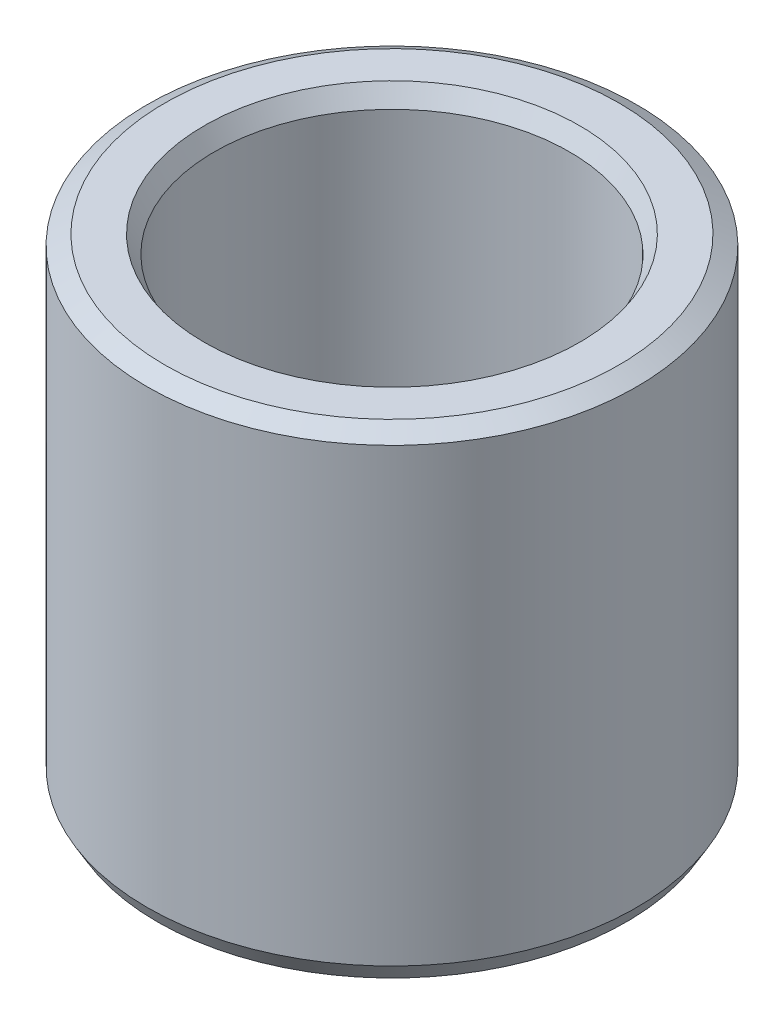
from build123d import *
from OCP.BRepFilletAPI import BRepFilletAPI_MakeChamfer

# Parameters (mm, degrees)
SKETCH1_R           = 37.5
BOSS_EXTRUDE1_DEPTH = 73.37793614
SKETCH2_R           = 27.222754913
CUT_EXTRUDE1_DEPTH  = 91.536299417
CHAMFER1_SIZE       = 1.555312904
CHAMFER1_SIZE2      = 2.693880972


with BuildPart() as part:
    # Sketch1 → Boss-Extrude1 (new body)
    with BuildSketch(Plane(origin=(0, 0, 0), x_dir=(1, 0, 0), z_dir=(0, 1, 0))):
        Circle(SKETCH1_R)
    extrude(amount=BOSS_EXTRUDE1_DEPTH)

    # Sketch2 → Cut-Extrude1 (cut, through all)
    with BuildSketch(Plane(origin=(0, 0, 0), x_dir=(1, 0, 0), z_dir=(0, 1, 0))):
        Circle(SKETCH2_R)
    extrude(amount=CUT_EXTRUDE1_DEPTH, mode=Mode.SUBTRACT)

    # Chamfer1: one chamfer whose edges measure the first distance from different faces: ONE call of the kernel's chamfer builder (chamfer() names one face for all edges)
    chamfer1_edges_1 = [part.edges().sort_by_distance(p)[0] for p in [
        (-27.222754913, 73.37793614, 0),
    ]]
    chamfer1_side_1 = [part.faces().sort_by_distance(p)[0] for p in [
        (-36.439339828, 73.37793614, 0),
    ]]
    chamfer1_edges_2 = [part.edges().sort_by_distance(p)[0] for p in [
        (-27.222754913, 0, 0),
    ]]
    chamfer1_side_2 = [part.faces().sort_by_distance(p)[0] for p in [
        (-27.222754913, 36.68896807, 0),
    ]]
    chamfer1_edges_3 = [part.edges().sort_by_distance(p)[0] for p in [
        (-37.5, 0, 0),
    ]]
    chamfer1_side_3 = [part.faces().sort_by_distance(p)[0] for p in [
        (-36.439339828, 0, 0),
    ]]
    chamfer1_edges_4 = [part.edges().sort_by_distance(p)[0] for p in [
        (-37.5, 73.37793614, 0),
    ]]
    chamfer1_side_4 = [part.faces().sort_by_distance(p)[0] for p in [
        (-37.5, 36.68896807, 0),
    ]]
    chamfer1 = BRepFilletAPI_MakeChamfer(part.part.solid().wrapped)
    for e in chamfer1_edges_1:
        chamfer1.Add(CHAMFER1_SIZE, CHAMFER1_SIZE2, e.wrapped, chamfer1_side_1[0].wrapped)  # the first distance lies on this face
    for e in chamfer1_edges_2:
        chamfer1.Add(CHAMFER1_SIZE, CHAMFER1_SIZE2, e.wrapped, chamfer1_side_2[0].wrapped)  # the first distance lies on this face
    for e in chamfer1_edges_3:
        chamfer1.Add(CHAMFER1_SIZE, CHAMFER1_SIZE2, e.wrapped, chamfer1_side_3[0].wrapped)  # the first distance lies on this face
    for e in chamfer1_edges_4:
        chamfer1.Add(CHAMFER1_SIZE, CHAMFER1_SIZE2, e.wrapped, chamfer1_side_4[0].wrapped)  # the first distance lies on this face
    add(Compound.cast(chamfer1.Shape()), mode=Mode.REPLACE)


solid = part.part
